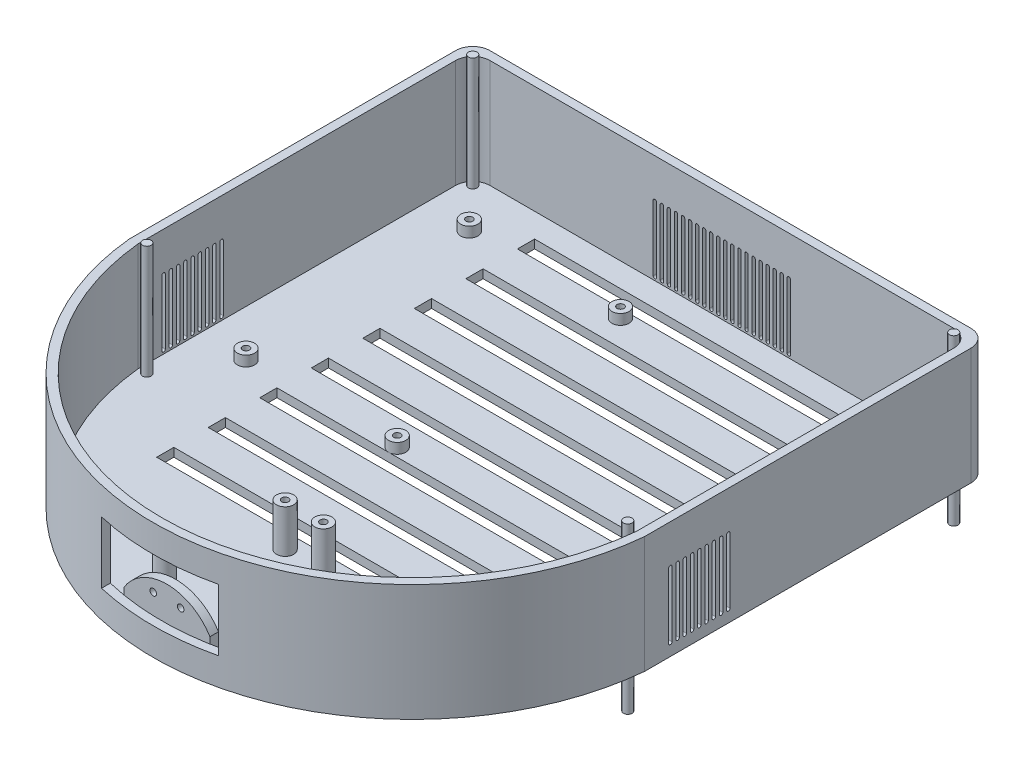
from build123d import *

# Parameters (mm, degrees)
BOSS_EXTRUDE1_DEPTH     = 86.36
SHELL1_START            = 6.35
SHELL1_DEPTH            = 80.01
FILLET2_R               = 12.7
BOSS_EXTRUDE2_START     = -38.1
SKETCH3_R               = 3.175
BOSS_EXTRUDE2_DEPTH     = 121.92
CUT_EXTRUDE4_DEPTH      = 6.35
CUT_EXTRUDE5_DEPTH      = 374.65
SKETCH11_R              = 6.35
SKETCH11_R_2            = 2.54
BOSS_EXTRUDE3_DEPTH     = 7.62
SKETCH12_W              = 241.3
SKETCH12_H              = 12.7
CUT_EXTRUDE6_DEPTH      = 6.35
LPATTERN1_COUNT         = 8
LPATTERN1_PITCH         = 38.1
CUT_EXTRUDE7_REACH      = 477.932
CUT_EXTRUDE7_END_RADIUS = 185.065147059
SKETCH13_W              = 86.36
SKETCH13_H              = 45.72
SKETCH14_W              = 63.5
SKETCH14_H              = 6.35
BOSS_EXTRUDE4_DEPTH     = 35.56
SKETCH15_R              = 2.413
CUT_EXTRUDE8_DEPTH      = 6.35
SKETCH17_R              = 6.35
SKETCH17_R_2            = 2.54
BOSS_EXTRUDE5_DEPTH     = 31.75


# Read off the part's stored shape, not the designer's step: Shell1
with BuildPart() as part:
    # Sketch1 → Boss-Extrude1 (new body)
    with BuildSketch(Plane(origin=(0, 0, 0), x_dir=(1, 0, 0), z_dir=(0, 1, 0))):
        with BuildLine():
            ThreePointArc((-190.5, -40.64), (-128.571428175, -163.751574858), (-4.5e-07, -213.36))
            ThreePointArc((-4.5e-07, -213.36), (128.571427841, -163.75157516), (190.5, -40.64))
            Line((190.5, -40.64), (190.5, 213.36))
            Line((190.5, 213.36), (-190.5, 213.36))
            Line((-190.5, 213.36), (-190.5, -40.64))
        make_face()
    extrude(amount=BOSS_EXTRUDE1_DEPTH)

    # Shell1 outline → Shell1 (cut)
    with BuildSketch(Plane(origin=(0, 0, 0), x_dir=(1, 0, 0), z_dir=(0, 1, 0)).offset(SHELL1_START)):
        with BuildLine():
            ThreePointArc((-184.15, -40.32653284), (0, -207.01), (184.15, -40.32653284))
            Line((184.15, -40.32653284), (184.15, 207.01))
            Line((184.15, 207.01), (-184.15, 207.01))
            Line((-184.15, 207.01), (-184.15, -40.32653284))
        make_face()
    extrude(amount=SHELL1_DEPTH, mode=Mode.SUBTRACT)

    # Fillet2
    fillet2_edges = [part.edges().sort_by_distance(p)[0] for p in [
        (184.15, 46.355, -207.01),
        (-184.15, 46.355, -207.01),
        (-190.5, 43.18, -213.36),
        (190.5, 43.18, -213.36),
    ]]
    fillet(fillet2_edges, radius=FILLET2_R)

    # Sketch3 → Boss-Extrude2 (add)
    with BuildSketch(Plane(origin=(0, 6.35, 0), x_dir=(1, 0, 0), z_dir=(0, 1, 0)).offset(BOSS_EXTRUDE2_START)):
        with Locations(Location((-177.8, 200.66, 0), (0, 0, 270))):
            Circle(SKETCH3_R)
        with Locations(Location((-177.8, -40.32653284, 0), (0, 0, 270))):
            Circle(SKETCH3_R)
    boss_extrude2 = extrude(amount=BOSS_EXTRUDE2_DEPTH)

    # Mirror1: Boss-Extrude2 across plane
    add(boss_extrude2.mirror(Plane(origin=(0, 0, 0), x_dir=(0, 0, 1), z_dir=(1, 0, 0))))

    # Sketch8 → Cut-Extrude4 (cut)
    with BuildSketch(Plane(origin=(0, 0, -213.36), x_dir=(-1, 0, 0), z_dir=(0, 0, -1))):
        with BuildLine():
            Line((-48.26, 57.15), (-48.26, 8.89))
            ThreePointArc((-48.26, 8.89), (-49.53, 7.62), (-50.8, 8.89))
            Line((-50.8, 8.89), (-50.8, 57.15))
            ThreePointArc((-50.8, 57.15), (-49.53, 58.42), (-48.26, 57.15))
        make_face()
        with BuildLine():
            Line((-45.586315789, 57.15), (-45.586315789, 8.89))
            ThreePointArc((-45.586315789, 8.89), (-44.316315789, 7.62), (-43.046315789, 8.89))
            Line((-43.046315789, 8.89), (-43.046315789, 57.15))
            ThreePointArc((-43.046315789, 57.15), (-44.316315789, 58.42), (-45.586315789, 57.15))
        make_face()
        with BuildLine():
            Line((-40.372631579, 57.15), (-40.372631579, 8.89))
            ThreePointArc((-40.372631579, 8.89), (-39.102631579, 7.62), (-37.832631579, 8.89))
            Line((-37.832631579, 8.89), (-37.832631579, 57.15))
            ThreePointArc((-37.832631579, 57.15), (-39.102631579, 58.42), (-40.372631579, 57.15))
        make_face()
        with BuildLine():
            Line((-35.158947368, 57.15), (-35.158947368, 8.89))
            ThreePointArc((-35.158947368, 8.89), (-33.888947368, 7.62), (-32.618947368, 8.89))
            Line((-32.618947368, 8.89), (-32.618947368, 57.15))
            ThreePointArc((-32.618947368, 57.15), (-33.888947368, 58.42), (-35.158947368, 57.15))
        make_face()
        with BuildLine():
            Line((-29.945263158, 57.15), (-29.945263158, 8.89))
            ThreePointArc((-29.945263158, 8.89), (-28.675263158, 7.62), (-27.405263158, 8.89))
            Line((-27.405263158, 8.89), (-27.405263158, 57.15))
            ThreePointArc((-27.405263158, 57.15), (-28.675263158, 58.42), (-29.945263158, 57.15))
        make_face()
        with BuildLine():
            Line((-24.731578947, 57.15), (-24.731578947, 8.89))
            ThreePointArc((-24.731578947, 8.89), (-23.461578947, 7.62), (-22.191578947, 8.89))
            Line((-22.191578947, 8.89), (-22.191578947, 57.15))
            ThreePointArc((-22.191578947, 57.15), (-23.461578947, 58.42), (-24.731578947, 57.15))
        make_face()
        with BuildLine():
            Line((-19.517894737, 57.15), (-19.517894737, 8.89))
            ThreePointArc((-19.517894737, 8.89), (-18.247894737, 7.62), (-16.977894737, 8.89))
            Line((-16.977894737, 8.89), (-16.977894737, 57.15))
            ThreePointArc((-16.977894737, 57.15), (-18.247894737, 58.42), (-19.517894737, 57.15))
        make_face()
        with BuildLine():
            Line((-14.304210526, 57.15), (-14.304210526, 8.89))
            ThreePointArc((-14.304210526, 8.89), (-13.034210526, 7.62), (-11.764210526, 8.89))
            Line((-11.764210526, 8.89), (-11.764210526, 57.15))
            ThreePointArc((-11.764210526, 57.15), (-13.034210526, 58.42), (-14.304210526, 57.15))
        make_face()
        with BuildLine():
            Line((-9.090526316, 57.15), (-9.090526316, 8.89))
            ThreePointArc((-9.090526316, 8.89), (-7.820526316, 7.62), (-6.550526316, 8.89))
            Line((-6.550526316, 8.89), (-6.550526316, 57.15))
            ThreePointArc((-6.550526316, 57.15), (-7.820526316, 58.42), (-9.090526316, 57.15))
        make_face()
        with BuildLine():
            Line((-3.876842105, 57.15), (-3.876842105, 8.89))
            ThreePointArc((-3.876842105, 8.89), (-2.606842105, 7.62), (-1.336842105, 8.89))
            Line((-1.336842105, 8.89), (-1.336842105, 57.15))
            ThreePointArc((-1.336842105, 57.15), (-2.606842105, 58.42), (-3.876842105, 57.15))
        make_face()
        with BuildLine():
            Line((1.336842105, 57.15), (1.336842105, 8.89))
            ThreePointArc((1.336842105, 8.89), (2.606842105, 7.62), (3.876842105, 8.89))
            Line((3.876842105, 8.89), (3.876842105, 57.15))
            ThreePointArc((3.876842105, 57.15), (2.606842105, 58.42), (1.336842105, 57.15))
        make_face()
        with BuildLine():
            Line((6.550526316, 57.15), (6.550526316, 8.89))
            ThreePointArc((6.550526316, 8.89), (7.820526316, 7.62), (9.090526316, 8.89))
            Line((9.090526316, 8.89), (9.090526316, 57.15))
            ThreePointArc((9.090526316, 57.15), (7.820526316, 58.42), (6.550526316, 57.15))
        make_face()
        with BuildLine():
            Line((11.764210526, 57.15), (11.764210526, 8.89))
            ThreePointArc((11.764210526, 8.89), (13.034210526, 7.62), (14.304210526, 8.89))
            Line((14.304210526, 8.89), (14.304210526, 57.15))
            ThreePointArc((14.304210526, 57.15), (13.034210526, 58.42), (11.764210526, 57.15))
        make_face()
        with BuildLine():
            Line((16.977894737, 57.15), (16.977894737, 8.89))
            ThreePointArc((16.977894737, 8.89), (18.247894737, 7.62), (19.517894737, 8.89))
            Line((19.517894737, 8.89), (19.517894737, 57.15))
            ThreePointArc((19.517894737, 57.15), (18.247894737, 58.42), (16.977894737, 57.15))
        make_face()
        with BuildLine():
            Line((22.191578947, 57.15), (22.191578947, 8.89))
            ThreePointArc((22.191578947, 8.89), (23.461578947, 7.62), (24.731578947, 8.89))
            Line((24.731578947, 8.89), (24.731578947, 57.15))
            ThreePointArc((24.731578947, 57.15), (23.461578947, 58.42), (22.191578947, 57.15))
        make_face()
        with BuildLine():
            Line((27.405263158, 57.15), (27.405263158, 8.89))
            ThreePointArc((27.405263158, 8.89), (28.675263158, 7.62), (29.945263158, 8.89))
            Line((29.945263158, 8.89), (29.945263158, 57.15))
            ThreePointArc((29.945263158, 57.15), (28.675263158, 58.42), (27.405263158, 57.15))
        make_face()
        with BuildLine():
            Line((32.618947368, 57.15), (32.618947368, 8.89))
            ThreePointArc((32.618947368, 8.89), (33.888947368, 7.62), (35.158947368, 8.89))
            Line((35.158947368, 8.89), (35.158947368, 57.15))
            ThreePointArc((35.158947368, 57.15), (33.888947368, 58.42), (32.618947368, 57.15))
        make_face()
        with BuildLine():
            Line((37.832631579, 57.15), (37.832631579, 8.89))
            ThreePointArc((37.832631579, 8.89), (39.102631579, 7.62), (40.372631579, 8.89))
            Line((40.372631579, 8.89), (40.372631579, 57.15))
            ThreePointArc((40.372631579, 57.15), (39.102631579, 58.42), (37.832631579, 57.15))
        make_face()
        with BuildLine():
            Line((43.046315789, 57.15), (43.046315789, 8.89))
            ThreePointArc((43.046315789, 8.89), (44.316315789, 7.62), (45.586315789, 8.89))
            Line((45.586315789, 8.89), (45.586315789, 57.15))
            ThreePointArc((45.586315789, 57.15), (44.316315789, 58.42), (43.046315789, 57.15))
        make_face()
        with BuildLine():
            Line((48.26, 57.15), (48.26, 8.89))
            ThreePointArc((48.26, 8.89), (49.53, 7.62), (50.8, 8.89))
            Line((50.8, 8.89), (50.8, 57.15))
            ThreePointArc((50.8, 57.15), (49.53, 58.42), (48.26, 57.15))
        make_face()
    extrude(amount=-CUT_EXTRUDE4_DEPTH, mode=Mode.SUBTRACT)

    # Sketch10 → Cut-Extrude5 (cut)
    with BuildSketch(Plane(origin=(190.5, 0, 0), x_dir=(0, 0, -1), z_dir=(1, 0, 0))):
        with BuildLine():
            ThreePointArc((-20.32, 57.15), (-20.691974388, 58.048025612), (-21.59, 58.42))
            ThreePointArc((-21.59, 58.42), (-22.488025612, 58.048025612), (-22.86, 57.15))
            Line((-22.86, 57.15), (-22.86, 8.89))
            ThreePointArc((-22.86, 8.89), (-22.488025613, 7.991974389), (-21.590000002, 7.62))
            ThreePointArc((-21.590000002, 7.62), (-20.691974389, 7.991974387), (-20.32, 8.89))
            Line((-20.32, 8.89), (-20.32, 57.15))
        make_face()
        with BuildLine():
            Line((-17.497777778, 57.15), (-17.497777778, 8.89))
            ThreePointArc((-17.497777778, 8.89), (-16.227777778, 7.62), (-14.957777778, 8.89))
            Line((-14.957777778, 8.89), (-14.957777778, 57.15))
            ThreePointArc((-14.957777778, 57.15), (-16.227777778, 58.42), (-17.497777778, 57.15))
        make_face()
        with BuildLine():
            Line((-6.773333333, 57.15), (-6.773333333, 8.89))
            ThreePointArc((-6.773333333, 8.89), (-5.503333333, 7.62), (-4.233333333, 8.89))
            Line((-4.233333333, 8.89), (-4.233333333, 57.15))
            ThreePointArc((-4.233333333, 57.15), (-5.503333333, 58.42), (-6.773333333, 57.15))
        make_face()
        with BuildLine():
            Line((3.951111111, 57.15), (3.951111111, 8.89))
            ThreePointArc((3.951111111, 8.89), (5.221111111, 7.62), (6.491111111, 8.89))
            Line((6.491111111, 8.89), (6.491111111, 57.15))
            ThreePointArc((6.491111111, 57.15), (5.221111111, 58.42), (3.951111111, 57.15))
        make_face()
        with BuildLine():
            Line((9.313333333, 57.15), (9.313333333, 8.89))
            ThreePointArc((9.313333333, 8.89), (10.583333333, 7.62), (11.853333333, 8.89))
            Line((11.853333333, 8.89), (11.853333333, 57.15))
            ThreePointArc((11.853333333, 57.15), (10.583333333, 58.42), (9.313333333, 57.15))
        make_face()
        with BuildLine():
            Line((14.675555556, 57.15), (14.675555556, 8.89))
            ThreePointArc((14.675555556, 8.89), (15.945555556, 7.62), (17.215555556, 8.89))
            Line((17.215555556, 8.89), (17.215555556, 57.15))
            ThreePointArc((17.215555556, 57.15), (15.945555556, 58.42), (14.675555556, 57.15))
        make_face()
        with BuildLine():
            Line((20.037777778, 57.15), (20.037777778, 8.89))
            ThreePointArc((20.037777778, 8.89), (21.307777778, 7.62), (22.577777778, 8.89))
            Line((22.577777778, 8.89), (22.577777778, 57.15))
            ThreePointArc((22.577777778, 57.15), (21.307777778, 58.42), (20.037777778, 57.15))
        make_face()
        with BuildLine():
            Line((-12.135555556, 57.15), (-12.135555556, 8.89))
            ThreePointArc((-12.135555556, 8.89), (-10.865555556, 7.62), (-9.595555556, 8.89))
            Line((-9.595555556, 8.89), (-9.595555556, 57.15))
            ThreePointArc((-9.595555556, 57.15), (-10.865555556, 58.42), (-12.135555556, 57.15))
        make_face()
        with BuildLine():
            Line((1.128888889, 57.15), (1.128888889, 8.89))
            ThreePointArc((1.128888889, 8.89), (-0.141111111, 7.62), (-1.411111111, 8.89))
            Line((-1.411111111, 8.89), (-1.411111111, 57.15))
            ThreePointArc((-1.411111111, 57.15), (-0.141111111, 58.42), (1.128888889, 57.15))
        make_face()
    cut_extrude5 = extrude(amount=-CUT_EXTRUDE5_DEPTH, mode=Mode.SUBTRACT)

    # Mirror2: Cut-Extrude5 across plane
    add(cut_extrude5.mirror(Plane(origin=(0, 0, 0), x_dir=(0, 0, 1), z_dir=(1, 0, 0))), mode=Mode.SUBTRACT)

    # Sketch11 → Boss-Extrude3 (add)
    # profile 1 of 4: a face of its own
    with BuildSketch(Plane(origin=(0, 6.35, 0), x_dir=(1, 0, 0), z_dir=(0, 1, 0))):
        with Locations(Location((-149.86, 170.18, 0), (0, 0, 90))):
            Circle(SKETCH11_R)
        with Locations(Location((-149.86, 170.18, 0), (0, 0, 90))):
            Circle(SKETCH11_R_2, mode=Mode.SUBTRACT)
    # profile 2 of 4: a face of its own
    with BuildSketch(Plane(origin=(0, 6.35, 0), x_dir=(1, 0, 0), z_dir=(0, 1, 0))):
        with Locations(Location((-149.86, 5.08, 0), (0, 0, 90))):
            Circle(SKETCH11_R)
        with Locations(Location((-149.86, 5.08, 0), (0, 0, 90))):
            Circle(SKETCH11_R_2, mode=Mode.SUBTRACT)
    # profile 3 of 4: a face of its own
    with BuildSketch(Plane(origin=(0, 6.35, 0), x_dir=(1, 0, 0), z_dir=(0, 1, 0))):
        with Locations(Location((-38.1, 170.18, 0), (0, 0, 90))):
            Circle(SKETCH11_R)
        with Locations(Location((-38.1, 170.18, 0), (0, 0, 90))):
            Circle(SKETCH11_R_2, mode=Mode.SUBTRACT)
    # profile 4 of 4: a face of its own
    with BuildSketch(Plane(origin=(0, 6.35, 0), x_dir=(1, 0, 0), z_dir=(0, 1, 0))):
        with Locations(Location((-38.1, 5.08, 0), (0, 0, 90))):
            Circle(SKETCH11_R)
        with Locations(Location((-38.1, 5.08, 0), (0, 0, 90))):
            Circle(SKETCH11_R_2, mode=Mode.SUBTRACT)
    extrude(amount=BOSS_EXTRUDE3_DEPTH)

    # Sketch12 → Cut-Extrude6 (cut)
    with BuildSketch(Plane(origin=(0, 6.35, 0), x_dir=(1, 0, 0), z_dir=(0, 1, 0))):
        with Locations((0, 182.88)):
            Rectangle(SKETCH12_W, SKETCH12_H)
    cut_extrude6 = extrude(amount=-CUT_EXTRUDE6_DEPTH, mode=Mode.SUBTRACT)

    # LPattern1: Cut-Extrude6 ×8
    with Locations(*[(0, 0, i * LPATTERN1_PITCH) for i in range(1, LPATTERN1_COUNT)]):
        add(cut_extrude6, mode=Mode.SUBTRACT)

    # Cut-Extrude7: up to this cylinder (the profile starts outside it)
    cut_extrude7_end = Plane(origin=(0, 43.18, 21.944852941), z_dir=(0, -1, 0)) * Cylinder(CUT_EXTRUDE7_END_RADIUS, 1326.994294118, mode=Mode.PRIVATE)
    # Sketch13 → Cut-Extrude7 (cut, up to the surface)
    with BuildSketch(Plane(origin=(0, 0, 213.36), x_dir=(-1, 0, 0), z_dir=(0, 0, -1)), mode=Mode.PRIVATE) as cut_extrude7_sk1:
        with Locations((0, 43.18)):
            Rectangle(SKETCH13_W, SKETCH13_H)
    cut_extrude7_tool1 = extrude(cut_extrude7_sk1.sketch, amount=CUT_EXTRUDE7_REACH, mode=Mode.PRIVATE) - cut_extrude7_end
    add(cut_extrude7_tool1.solids().sort_by_distance((0, 43.18, 213.36))[0], mode=Mode.SUBTRACT)

    # Sketch14 → Boss-Extrude4 (add)
    with BuildSketch(Plane(origin=(0, 6.35, 0), x_dir=(1, 0, 0), z_dir=(0, 1, 0))):
        with Locations((0, -200.025)):
            Rectangle(SKETCH14_W, SKETCH14_H)
    extrude(amount=BOSS_EXTRUDE4_DEPTH)

    # Sketch15 → Cut-Extrude8 (cut)
    with BuildSketch(Plane.XY.offset(203.2)):
        with BuildLine():
            Line((-31.75, 41.91), (-31.75, 24.13))
            ThreePointArc((-31.75, 24.13), (-18.194716953, 37.162351702), (0, 41.91))
            Line((0, 41.91), (-31.75, 41.91))
        make_face()
        with BuildLine():
            Line((31.75, 41.91), (0, 41.91))
            ThreePointArc((0, 41.91), (18.194716953, 37.162351702), (31.75, 24.13))
            Line((31.75, 24.13), (31.75, 41.91))
        make_face()
        with Locations((-10.16, 31.75)):
            Circle(SKETCH15_R)
        with Locations((10.16, 31.75)):
            Circle(SKETCH15_R)
    extrude(amount=-CUT_EXTRUDE8_DEPTH, mode=Mode.SUBTRACT)

    # Sketch17 → Boss-Extrude5 (add)
    # profile 1 of 4: a face of its own
    with BuildSketch(Plane(origin=(0, 6.35, 0), x_dir=(1, 0, 0), z_dir=(0, 1, 0))):
        with Locations(Location((31.75, -173.228, 0), (0, 0, 270))):
            Circle(SKETCH17_R)
        with Locations(Location((31.75, -173.228, 0), (0, 0, 270))):
            Circle(SKETCH17_R_2, mode=Mode.SUBTRACT)
    # profile 2 of 4: a face of its own
    with BuildSketch(Plane(origin=(0, 6.35, 0), x_dir=(1, 0, 0), z_dir=(0, 1, 0))):
        with Locations(Location((-31.75, -173.228, 0), (0, 0, 270))):
            Circle(SKETCH17_R)
        with Locations(Location((-31.75, -173.228, 0), (0, 0, 270))):
            Circle(SKETCH17_R_2, mode=Mode.SUBTRACT)
    # profile 3 of 4: a face of its own
    with BuildSketch(Plane(origin=(0, 6.35, 0), x_dir=(1, 0, 0), z_dir=(0, 1, 0))):
        with Locations(Location((14.154646808, -101.718576255, 0), (0, 0, 270))):
            Circle(SKETCH17_R)
        with Locations(Location((14.154646808, -101.718576255, 0), (0, 0, 270))):
            Circle(SKETCH17_R_2, mode=Mode.SUBTRACT)
    # profile 4 of 4: a face of its own
    with BuildSketch(Plane(origin=(0, 6.35, 0), x_dir=(1, 0, 0), z_dir=(0, 1, 0))):
        with Locations(Location((-14.154646808, -101.718576255, 0), (0, 0, 270))):
            Circle(SKETCH17_R)
        with Locations(Location((-14.154646808, -101.718576255, 0), (0, 0, 270))):
            Circle(SKETCH17_R_2, mode=Mode.SUBTRACT)
    extrude(amount=BOSS_EXTRUDE5_DEPTH)


solid = part.part
